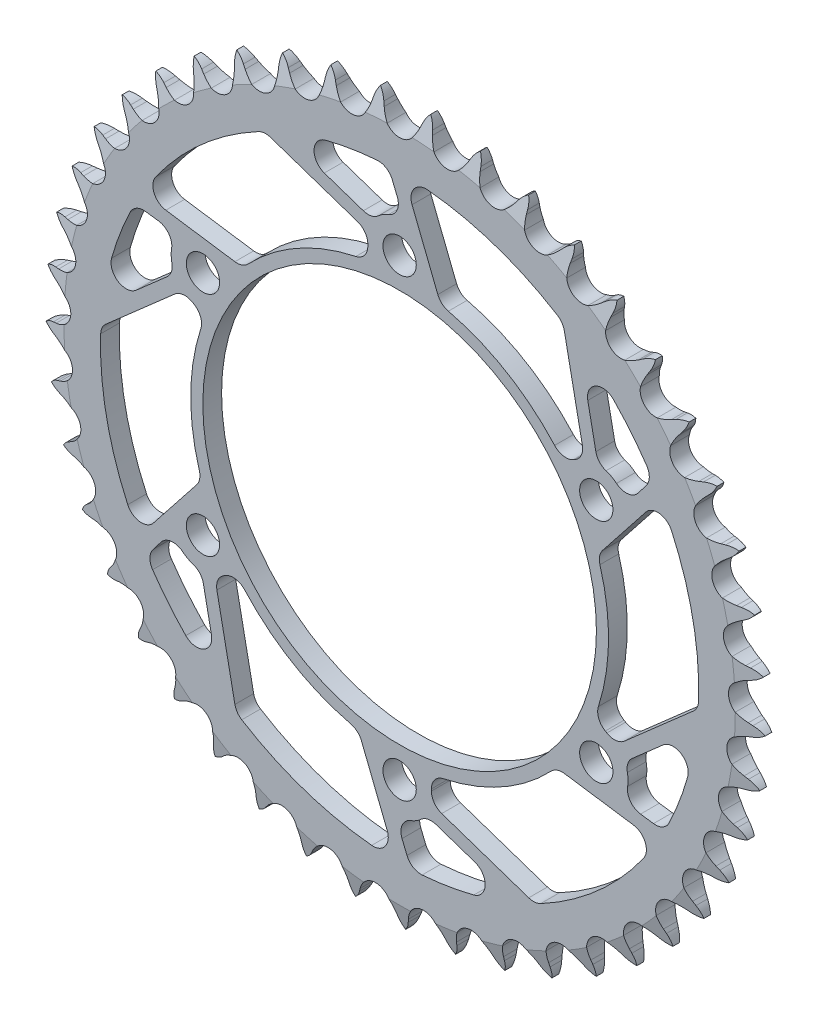
from build123d import *

# Parameters (mm, degrees)
BOSS_EXTRUDE2_DEPTH      = 6.1976
M10_CLEARANCE_HOLE1_D    = 11
SKETCH5_R                = 65
CUT_EXTRUDE1_DEPTH       = 169.066931826
CUT_EXTRUDE5_DEPTH       = 169.066931826
FILLET1_R                = 5
CIRPATTERN1_COUNT        = 6
FILLET1_OF_CIRPATTERN1_R = 5


with BuildPart() as part:
    # Sketch2 → Boss-Extrude2 (new body)
    with BuildSketch(Plane.XY):
        with BuildLine():
            Line((5.956451436, 114.157319132), (6.387056113, 115.368083346))
            ThreePointArc((6.387056113, 115.368083346), (7.1593932, 117.045110566), (8.28683305, 118.507233768))
            ThreePointArc((8.28683305, 118.507233768), (9.199812512, 116.902430548), (9.731236189, 115.134235494))
            Line((9.731236189, 115.134235494), (9.989144441, 113.875325767))
            ThreePointArc((9.989144441, 113.875325767), (10.526532851, 112.014172711), (11.32913636, 110.251077533))
            ThreePointArc((11.32913636, 110.251077533), (15.123673948, 107.610531699), (19.499050656, 109.102870958))
            ThreePointArc((19.499050656, 109.102870958), (20.75653756, 110.57643931), (21.786111761, 112.217370132))
            Line((21.786111761, 112.217370132), (22.381031633, 113.356422684))
            ThreePointArc((22.381031633, 113.356422684), (23.379249467, 114.909640643), (24.69920537, 116.200625263))
            ThreePointArc((24.69920537, 116.200625263), (25.379954338, 114.484377695), (25.660121047, 112.659430712))
            Line((25.660121047, 112.659430712), (25.740312983, 111.376878716))
            ThreePointArc((25.740312983, 111.376878716), (26.013449124, 109.459048263), (26.562866328, 107.601410587))
            ThreePointArc((26.562866328, 107.601410587), (29.952982785, 104.458464801), (34.493472111, 105.327345972))
            ThreePointArc((34.493472111, 105.327345972), (35.943802315, 106.611565307), (37.191730202, 108.093237669))
            Line((37.191730202, 108.093237669), (37.939385831, 109.138408195))
            ThreePointArc((37.939385831, 109.138408195), (39.144055237, 110.537585273), (40.630835752, 111.632303763))
            ThreePointArc((40.630835752, 111.632303763), (41.066104223, 109.838016654), (41.089560838, 107.99183826))
            Line((41.089560838, 107.99183826), (40.990475613, 106.710607411))
            ThreePointArc((40.990475613, 106.710607411), (40.994043201, 104.773427948), (41.279580318, 102.857404578))
            ThreePointArc((41.279580318, 102.857404578), (44.199290883, 99.273232705), (48.816517366, 99.501744005))
            ThreePointArc((48.816517366, 99.501744005), (50.431461843, 100.571618453), (51.873453919, 101.865193288))
            Line((51.873453919, 101.865193288), (52.759293038, 102.796138735))
            ThreePointArc((52.759293038, 102.796138735), (54.146966498, 104.01404154), (55.771633134, 104.891186451))
            ThreePointArc((55.771633134, 104.891186451), (55.9529491, 103.053783557), (55.719239065, 101.222307515))
            Line((55.719239065, 101.222307515), (55.442805261, 99.967335515))
            ThreePointArc((55.442805261, 99.967335515), (55.176734856, 98.048512037), (55.192834232, 96.111396188))
            ThreePointArc((55.192834232, 96.111396188), (57.585310061, 92.155760056), (62.189404639, 91.739453773))
            ThreePointArc((62.189404639, 91.739453773), (63.937530332, 92.574159445), (65.545519861, 93.65445879))
            Line((65.545519861, 93.65445879), (66.55230062, 94.453059362))
            ThreePointArc((66.55230062, 94.453059362), (68.095968646, 95.465982803), (69.826899116, 96.108481506))
            ThreePointArc((69.826899116, 96.108481506), (69.750733469, 94.263725785), (69.264405684, 92.482599692))
            Line((69.264405684, 92.482599692), (68.81600377, 91.278313143))
            ThreePointArc((68.81600377, 91.278313143), (68.28547413, 89.415193367), (68.031822408, 87.494688797))
            ThreePointArc((68.031822408, 87.494688797), (69.85049668, 83.244580363), (74.35184589, 82.191559424))
            ThreePointArc((74.35184589, 82.191559424), (76.199127521, 82.774849725), (77.941816816, 83.620846782))
            Line((77.941816816, 83.620846782), (79.049943371, 84.271558628))
            ThreePointArc((79.049943371, 84.271558628), (80.719560223, 85.059787301), (82.523063933, 85.45513429))
            ThreePointArc((82.523063933, 85.45513429), (82.190899151, 83.638931815), (81.461419433, 81.942823264))
            Line((81.461419433, 81.942823264), (80.849777042, 80.812662234))
            ThreePointArc((80.849777042, 80.812662234), (80.065114323, 79.041509666), (79.546648547, 77.174996811))
            ThreePointArc((79.546648547, 77.174996811), (80.756122835, 72.713139603), (85.067113035, 71.043899863))
            ThreePointArc((85.067113035, 71.043899863), (86.977595368, 71.36442171), (88.821064964, 71.959650108))
            Line((88.821064964, 71.959650108), (90.008968894, 72.449807863))
            ThreePointArc((90.008968894, 72.449807863), (91.772037378, 72.997999794), (93.61301118, 73.138500089))
            ThreePointArc((93.61301118, 73.138500089), (93.031312472, 71.386201174), (92.072879314, 69.80812299))
            Line((92.072879314, 69.80812299), (91.30990137, 68.774084777))
            ThreePointArc((91.30990137, 68.774084777), (90.28637814, 67.129372889), (89.513189654, 65.353181298))
            ThreePointArc((89.513189654, 65.353181298), (90.089922918, 60.76642029), (94.126645586, 58.513451603))
            ThreePointArc((94.126645586, 58.513451603), (96.063143256, 58.564966402), (97.971512115, 58.897840698))
            Line((97.971512115, 58.897840698), (99.21607222, 59.217903998))
            ThreePointArc((99.21607222, 59.217903998), (101.038276214, 59.515389255), (102.880887647, 59.398308178))
            ThreePointArc((102.880887647, 59.398308178), (102.060977118, 57.744019328), (100.892245331, 56.314687007))
            Line((100.892245331, 56.314687007), (99.99278233, 55.39689799))
            ThreePointArc((99.99278233, 55.39689799), (98.750320304, 53.910639226), (97.737458344, 52.259340449))
            ThreePointArc((97.737458344, 52.259340449), (97.670225127, 47.636951727), (101.354110049, 44.844105565))
            ThreePointArc((101.354110049, 44.844105565), (103.278931331, 44.62561064), (105.215055224, 44.689651814))
            Line((105.215055224, 44.689651814), (106.492047557, 44.833390991))
            ThreePointArc((106.492047557, 44.833390991), (108.337919933, 44.874379361), (110.146304662, 44.501995762))
            ThreePointArc((110.146304662, 44.501995762), (109.104140936, 42.977915829), (107.747858555, 41.725149699))
            Line((107.747858555, 41.725149699), (106.729417523, 40.941473596))
            ThreePointArc((106.729417523, 40.941473596), (105.292199811, 39.642596294), (104.059378583, 38.148330983))
            ThreePointArc((104.059378583, 38.148330983), (103.349487502, 33.580284085), (106.608832049, 30.301920022))
            ThreePointArc((106.608832049, 30.301920022), (108.484512486, 29.817668128), (110.410706963, 29.611629692))
            Line((110.410706963, 29.611629692), (111.695276321, 29.576247026))
            ThreePointArc((111.695276321, 29.576247026), (113.528889273, 29.359940718), (115.267849146, 28.739502619))
            ThreePointArc((115.267849146, 28.739502619), (114.023716755, 27.375296085), (112.506282274, 26.323479813))
            Line((112.506282274, 26.323479813), (111.388686007, 25.689169989))
            ThreePointArc((111.388686007, 25.689169989), (109.784686417, 24.602955317), (108.355901383, 23.294807647))
            ThreePointArc((108.355901383, 23.294807647), (107.017169662, 18.87001441), (109.788534398, 15.169942073))
            ThreePointArc((109.788534398, 15.169942073), (111.578566005, 14.429358622), (113.457339881, 13.95725088))
            Line((113.457339881, 13.95725088), (114.724483584, 13.743435054))
            ThreePointArc((114.724483584, 13.743435054), (116.51014792, 13.274044224), (118.145836061, 12.417627749))
            ThreePointArc((118.145836061, 12.417627749), (116.723950628, 11.239847342), (115.074899183, 10.409453336))
            Line((115.074899183, 10.409453336), (113.87990042, 9.936855909))
            ThreePointArc((113.87990042, 9.936855909), (112.14033898, 9.0844458), (110.543399816, 7.987877377))
            ThreePointArc((110.543399816, 7.987877377), (108.601884344, 3.79246137), (110.831327808, -0.257301542))
            ThreePointArc((110.831327808, -0.257301542), (112.500869655, -1.239801935), (114.295654735, -1.968789944))
            Line((114.295654735, -1.968789944), (115.52070927, -2.356877247))
            ThreePointArc((115.52070927, -2.356877247), (117.223669066, -3.070216441), (118.724248666, -4.145942121))
            ThreePointArc((118.724248666, -4.145942121), (117.152285573, -5.114372245), (115.403714074, -5.70718131))
            Line((115.403714074, -5.70718131), (114.154572108, -6.008867768))
            ThreePointArc((114.154572108, -6.008867768), (112.313307402, -6.61088212), (110.579296712, -7.474527839))
            ThreePointArc((110.579296712, -7.474527839), (108.07278688, -11.358907618), (109.716915491, -15.679537076))
            ThreePointArc((109.716915491, -15.679537076), (111.233471845, -16.884831159), (112.909334678, -17.856510512))
            Line((112.909334678, -17.856510512), (114.068455753, -18.411315614))
            ThreePointArc((114.068455753, -18.411315614), (115.655564835, -19.354718836), (116.991828818, -20.628815943))
            ThreePointArc((116.991828818, -20.628815943), (115.300384538, -21.369046394), (113.486326941, -21.712732164))
            Line((113.486326941, -21.712732164), (112.207354899, -21.837635669))
            ThreePointArc((112.207354899, -21.837635669), (110.30022505, -22.17753674), (108.462893381, -22.791449874))
            ThreePointArc((108.462893381, -22.791449874), (105.44017555, -26.289188389), (106.466988215, -30.796588256))
            ThreePointArc((106.466988215, -30.796588256), (107.801041032, -32.20121635), (109.325362854, -33.396674413))
            Line((109.325362854, -33.396674413), (110.395989497, -34.107398665))
            ThreePointArc((110.395989497, -34.107398665), (111.836356589, -35.262503644), (112.982296098, -36.710173328))
            ThreePointArc((112.982296098, -36.710173328), (111.20429267, -37.207796361), (109.360057543, -37.295669384))
            Line((109.360057543, -37.295669384), (108.076149161, -37.241358831))
            ThreePointArc((108.076149161, -37.241358831), (106.140274282, -37.312530834), (104.235383204, -37.664762261))
            ThreePointArc((104.235383204, -37.664762261), (100.75529114, -40.707780012), (101.144802118, -45.314218876))
            ThreePointArc((101.144802118, -45.314218876), (102.270385577, -46.890841493), (103.613497198, -48.286810036))
            Line((103.613497198, -48.286810036), (104.574790878, -49.139619998))
            ThreePointArc((104.574790878, -49.139619998), (105.840380875, -50.483943929), (106.773691501, -52.077008946))
            ThreePointArc((106.773691501, -52.077008946), (104.943735739, -52.322338896), (103.10521902, -52.152688823))
            Line((103.10521902, -52.152688823), (101.841364114, -51.920221306))
            ThreePointArc((101.841364114, -51.920221306), (99.914423809, -51.721278957), (97.979049859, -51.804972894))
            ThreePointArc((97.979049859, -51.804972894), (94.109319595, -54.334041002), (93.853947498, -58.949859769))
            ThreePointArc((93.853947498, -58.949859769), (94.749153398, -60.667789744), (95.884912678, -62.237097826))
            Line((95.884912678, -62.237097826), (96.718162906, -63.215394522))
            ThreePointArc((96.718162906, -63.215394522), (97.784342539, -64.72277167), (98.486858451, -66.430224822))
            ThreePointArc((98.486858451, -66.430224822), (96.640568363, -66.41848662), (94.843554689, -65.994615497))
            Line((94.843554689, -65.994615497), (93.624352758, -65.588515731))
            ThreePointArc((93.624352758, -65.588515731), (91.743852726, -65.123331218), (89.815665758, -64.936858657))
            ThreePointArc((89.815665758, -64.936858657), (85.631617192, -66.902751687), (84.736332548, -71.438108697))
            ThreePointArc((84.736332548, -71.438108697), (85.383736723, -73.263908476), (86.2900374, -74.976011301))
            Line((86.2900374, -74.976011301), (86.979025909, -76.060753299))
            ThreePointArc((86.979025909, -76.060753299), (87.825043203, -77.701844282), (88.283090729, -79.490451935))
            ThreePointArc((88.283090729, -79.490451935), (86.456402251, -79.221874051), (84.735868449, -78.552032047))
            Line((84.735868449, -78.552032047), (83.585049871, -77.980204303))
            ThreePointArc((83.585049871, -77.980204303), (81.787591908, -77.257831913), (79.904121887, -76.804822331))
            ThreePointArc((79.904121887, -76.804822331), (75.487192765, -78.169276411), (73.96942127, -82.535896099))
            ThreePointArc((73.96942127, -82.535896099), (74.356422735, -84.434028567), (75.015624697, -86.255602))
            Line((75.015624697, -86.255602), (75.54694111, -87.425676031))
            ThreePointArc((75.54694111, -87.425676031), (76.156329301, -89.168538879), (76.360993066, -91.00348782))
            ThreePointArc((76.360993066, -91.00348782), (74.589460612, -90.483297818), (72.978894916, -89.580522646))
            Line((72.978894916, -89.580522646), (71.918859065, -88.8540969))
            ThreePointArc((71.918859065, -88.8540969), (70.239428645, -87.88859679), (68.437335173, -87.177867502))
            ThreePointArc((68.437335173, -87.177867502), (63.873495996, -87.914325087), (61.762779346, -92.027216166))
            ThreePointArc((61.762779346, -92.027216166), (61.881845558, -93.960736333), (62.281118189, -95.85632552))
            Line((62.281118189, -95.85632552), (62.644421036, -97.088957424))
            ThreePointArc((62.644421036, -97.088957424), (63.005319075, -98.899669295), (62.952615532, -100.74524433))
            ThreePointArc((62.952615532, -100.74524433), (61.270719966, -99.983567116), (59.801470205, -98.865430267))
            Line((59.801470205, -98.865430267), (58.852849474, -97.99854557))
            ThreePointArc((58.852849474, -97.99854557), (57.324134799, -96.808710101), (55.638493576, -95.854094646))
            ThreePointArc((55.638493576, -95.854094646), (51.016574283, -95.948221425), (48.353995177, -99.72733115))
            ThreePointArc((48.353995177, -99.72733115), (48.202808647, -101.658605246), (48.334380559, -103.591314699))
            Line((48.334380559, -103.591314699), (48.522598563, -104.862512698))
            ThreePointArc((48.522598563, -104.862512698), (48.627981981, -106.705830144), (48.318936945, -108.526109255))
            ThreePointArc((48.318936945, -108.526109255), (46.759414451, -107.537770009), (45.460077899, -106.226034747))
            Line((45.460077899, -106.226034747), (44.641336112, -105.235564023))
            ThreePointArc((44.641336112, -105.235564023), (43.293091875, -103.844551989), (41.75671199, -102.66463087))
            ThreePointArc((41.75671199, -102.66463087), (37.166672982, -102.114594773), (34.004055493, -105.486367071))
            ThreePointArc((34.004055493, -105.486367071), (33.585558896, -107.377805042), (33.446869191, -109.310016771))
            Line((33.446869191, -109.310016771), (33.456338903, -110.595038441))
            ThreePointArc((33.456338903, -110.595038441), (33.304156532, -112.435083386), (32.744785212, -114.194636909))
            ThreePointArc((32.744785212, -114.194636909), (31.337990121, -112.998872532), (30.233856888, -111.51907029))
            Line((30.233856888, -111.51907029), (29.560929921, -110.424291926))
            ThreePointArc((29.560929921, -110.424291926), (28.419398163, -108.859177794), (27.062183502, -107.476916833))
            ThreePointArc((27.062183502, -107.476916833), (22.593364667, -106.293423688), (18.992265548, -109.192230846))
            ThreePointArc((18.992265548, -109.192230846), (18.314604443, -111.007018004), (17.908352559, -112.901123704))
            Line((17.908352559, -112.901123704), (17.738889662, -114.174957562))
            ThreePointArc((17.738889662, -114.174957562), (17.332103558, -115.975915623), (16.533293482, -117.640495851))
            ThreePointArc((16.533293482, -117.640495851), (15.30660746, -116.260580536), (14.419168243, -114.641513981))
            Line((14.419168243, -114.641513981), (13.905153855, -113.463736592))
            ThreePointArc((13.905153855, -113.463736592), (12.992553192, -111.754983529), (11.840920395, -110.197286863))
            ThreePointArc((11.840920395, -110.197286863), (7.580302209, -108.403372017), (3.610812758, -110.772792052))
            ThreePointArc((3.610812758, -110.772792052), (2.687177048, -112.475605628), (2.021270215, -114.294738688))
            Line((2.021270215, -114.294738688), (1.676173111, -115.532591005))
            ThreePointArc((1.676173111, -115.532591005), (1.022700904, -117.259408583), (0, -118.796616355))
            ThreePointArc((0, -118.796616355), (-1.022700904, -117.259408583), (-1.676173111, -115.532591005))
            Line((-1.676173111, -115.532591005), (-2.021270215, -114.294738688))
            ThreePointArc((-2.021270215, -114.294738688), (-2.687177048, -112.475605628), (-3.610812758, -110.772792052))
            ThreePointArc((-3.610812758, -110.772792052), (-7.580302209, -108.403372017), (-11.840920395, -110.197286863))
            ThreePointArc((-11.840920395, -110.197286863), (-12.992553192, -111.754983529), (-13.905153855, -113.463736592))
            Line((-13.905153855, -113.463736592), (-14.419168243, -114.641513981))
            ThreePointArc((-14.419168243, -114.641513981), (-15.30660746, -116.260580536), (-16.533293482, -117.640495851))
            ThreePointArc((-16.533293482, -117.640495851), (-17.332103558, -115.975915623), (-17.738889662, -114.174957562))
            Line((-17.738889662, -114.174957562), (-17.908352559, -112.901123704))
            ThreePointArc((-17.908352559, -112.901123704), (-18.314604443, -111.007018004), (-18.992265548, -109.192230846))
            ThreePointArc((-18.992265548, -109.192230846), (-22.593364667, -106.293423688), (-27.062183502, -107.476916833))
            ThreePointArc((-27.062183502, -107.476916833), (-28.419398163, -108.859177794), (-29.560929921, -110.424291926))
            Line((-29.560929921, -110.424291926), (-30.233856888, -111.51907029))
            ThreePointArc((-30.233856888, -111.51907029), (-31.337990121, -112.998872532), (-32.744785212, -114.194636909))
            ThreePointArc((-32.744785212, -114.194636909), (-33.304156532, -112.435083386), (-33.456338903, -110.595038441))
            Line((-33.456338903, -110.595038441), (-33.446869191, -109.310016771))
            ThreePointArc((-33.446869191, -109.310016771), (-33.585558896, -107.377805042), (-34.004055493, -105.486367071))
            ThreePointArc((-34.004055493, -105.486367071), (-37.166672982, -102.114594773), (-41.75671199, -102.66463087))
            ThreePointArc((-41.75671199, -102.66463087), (-43.293091875, -103.844551989), (-44.641336112, -105.235564023))
            Line((-44.641336112, -105.235564023), (-45.460077899, -106.226034747))
            ThreePointArc((-45.460077899, -106.226034747), (-46.759414451, -107.537770009), (-48.318936945, -108.526109255))
            ThreePointArc((-48.318936945, -108.526109255), (-48.627981981, -106.705830144), (-48.522598563, -104.862512698))
            Line((-48.522598563, -104.862512698), (-48.334380559, -103.591314699))
            ThreePointArc((-48.334380559, -103.591314699), (-48.202808647, -101.658605246), (-48.353995177, -99.72733115))
            ThreePointArc((-48.353995177, -99.72733115), (-51.016574283, -95.948221425), (-55.638493576, -95.854094646))
            ThreePointArc((-55.638493576, -95.854094646), (-57.324134799, -96.808710101), (-58.852849474, -97.99854557))
            Line((-58.852849474, -97.99854557), (-59.801470205, -98.865430267))
            ThreePointArc((-59.801470205, -98.865430267), (-61.270719966, -99.983567116), (-62.952615532, -100.74524433))
            ThreePointArc((-62.952615532, -100.74524433), (-63.005319075, -98.899669295), (-62.644421036, -97.088957424))
            Line((-62.644421036, -97.088957424), (-62.281118189, -95.85632552))
            ThreePointArc((-62.281118189, -95.85632552), (-61.881845558, -93.960736333), (-61.762779346, -92.027216166))
            ThreePointArc((-61.762779346, -92.027216166), (-63.873495996, -87.914325087), (-68.437335173, -87.177867502))
            ThreePointArc((-68.437335173, -87.177867502), (-70.239428645, -87.88859679), (-71.918859065, -88.8540969))
            Line((-71.918859065, -88.8540969), (-72.978894916, -89.580522646))
            ThreePointArc((-72.978894916, -89.580522646), (-74.589460612, -90.483297818), (-76.360993066, -91.00348782))
            ThreePointArc((-76.360993066, -91.00348782), (-76.156329301, -89.168538879), (-75.54694111, -87.425676031))
            Line((-75.54694111, -87.425676031), (-75.015624697, -86.255602))
            ThreePointArc((-75.015624697, -86.255602), (-74.356422735, -84.434028567), (-73.96942127, -82.535896099))
            ThreePointArc((-73.96942127, -82.535896099), (-75.487192765, -78.169276411), (-79.904121887, -76.804822331))
            ThreePointArc((-79.904121887, -76.804822331), (-81.787591908, -77.257831913), (-83.585049871, -77.980204303))
            Line((-83.585049871, -77.980204303), (-84.735868449, -78.552032047))
            ThreePointArc((-84.735868449, -78.552032047), (-86.456402251, -79.221874051), (-88.283090729, -79.490451935))
            ThreePointArc((-88.283090729, -79.490451935), (-87.825043203, -77.701844282), (-86.979025909, -76.060753299))
            Line((-86.979025909, -76.060753299), (-86.2900374, -74.976011301))
            ThreePointArc((-86.2900374, -74.976011301), (-85.383736723, -73.263908476), (-84.736332548, -71.438108697))
            ThreePointArc((-84.736332548, -71.438108697), (-85.631617192, -66.902751687), (-89.815665758, -64.936858657))
            ThreePointArc((-89.815665758, -64.936858657), (-91.743852726, -65.123331218), (-93.624352758, -65.588515731))
            Line((-93.624352758, -65.588515731), (-94.843554689, -65.994615497))
            ThreePointArc((-94.843554689, -65.994615497), (-96.640568363, -66.41848662), (-98.486858451, -66.430224822))
            ThreePointArc((-98.486858451, -66.430224822), (-97.784342539, -64.72277167), (-96.718162906, -63.215394522))
            Line((-96.718162906, -63.215394522), (-95.884912678, -62.237097826))
            ThreePointArc((-95.884912678, -62.237097826), (-94.749153398, -60.667789744), (-93.853947498, -58.949859769))
            ThreePointArc((-93.853947498, -58.949859769), (-94.109319595, -54.334041002), (-97.979049859, -51.804972894))
            ThreePointArc((-97.979049859, -51.804972894), (-99.914423809, -51.721278957), (-101.841364114, -51.920221306))
            Line((-101.841364114, -51.920221306), (-103.10521902, -52.152688823))
            ThreePointArc((-103.10521902, -52.152688823), (-104.943735739, -52.322338896), (-106.773691501, -52.077008946))
            ThreePointArc((-106.773691501, -52.077008946), (-105.840380875, -50.483943929), (-104.574790878, -49.139619998))
            Line((-104.574790878, -49.139619998), (-103.613497198, -48.286810036))
            ThreePointArc((-103.613497198, -48.286810036), (-102.270385577, -46.890841493), (-101.144802118, -45.314218876))
            ThreePointArc((-101.144802118, -45.314218876), (-100.75529114, -40.707780012), (-104.235383204, -37.664762261))
            ThreePointArc((-104.235383204, -37.664762261), (-106.140274282, -37.312530834), (-108.076149161, -37.241358831))
            Line((-108.076149161, -37.241358831), (-109.360057543, -37.295669384))
            ThreePointArc((-109.360057543, -37.295669384), (-111.20429267, -37.207796361), (-112.982296098, -36.710173328))
            ThreePointArc((-112.982296098, -36.710173328), (-111.836356589, -35.262503644), (-110.395989497, -34.107398665))
            Line((-110.395989497, -34.107398665), (-109.325362854, -33.396674413))
            ThreePointArc((-109.325362854, -33.396674413), (-107.801041032, -32.20121635), (-106.466988215, -30.796588256))
            ThreePointArc((-106.466988215, -30.796588256), (-105.44017555, -26.289188389), (-108.462893381, -22.791449874))
            ThreePointArc((-108.462893381, -22.791449874), (-110.30022505, -22.17753674), (-112.207354899, -21.837635669))
            Line((-112.207354899, -21.837635669), (-113.486326941, -21.712732164))
            ThreePointArc((-113.486326941, -21.712732164), (-115.300384538, -21.369046394), (-116.991828818, -20.628815943))
            ThreePointArc((-116.991828818, -20.628815943), (-115.655564835, -19.354718836), (-114.068455753, -18.411315614))
            Line((-114.068455753, -18.411315614), (-112.909334678, -17.856510512))
            ThreePointArc((-112.909334678, -17.856510512), (-111.233471845, -16.884831159), (-109.716915491, -15.679537076))
            ThreePointArc((-109.716915491, -15.679537076), (-108.07278688, -11.358907618), (-110.579296712, -7.474527839))
            ThreePointArc((-110.579296712, -7.474527839), (-112.313307402, -6.61088212), (-114.154572108, -6.008867768))
            Line((-114.154572108, -6.008867768), (-115.403714074, -5.70718131))
            ThreePointArc((-115.403714074, -5.70718131), (-117.152285573, -5.114372245), (-118.724248666, -4.145942121))
            ThreePointArc((-118.724248666, -4.145942121), (-117.223669066, -3.070216441), (-115.52070927, -2.356877247))
            Line((-115.52070927, -2.356877247), (-114.295654735, -1.968789944))
            ThreePointArc((-114.295654735, -1.968789944), (-112.500869655, -1.239801935), (-110.831327808, -0.257301542))
            ThreePointArc((-110.831327808, -0.257301542), (-108.601884344, 3.79246137), (-110.543399816, 7.987877377))
            ThreePointArc((-110.543399816, 7.987877377), (-112.14033898, 9.0844458), (-113.87990042, 9.936855909))
            Line((-113.87990042, 9.936855909), (-115.074899183, 10.409453336))
            ThreePointArc((-115.074899183, 10.409453336), (-116.723950628, 11.239847342), (-118.145836061, 12.417627749))
            ThreePointArc((-118.145836061, 12.417627749), (-116.51014792, 13.274044224), (-114.724483584, 13.743435054))
            Line((-114.724483584, 13.743435054), (-113.457339881, 13.95725088))
            ThreePointArc((-113.457339881, 13.95725088), (-111.578566005, 14.429358622), (-109.788534398, 15.169942073))
            ThreePointArc((-109.788534398, 15.169942073), (-107.017169662, 18.87001441), (-108.355901383, 23.294807647))
            ThreePointArc((-108.355901383, 23.294807647), (-109.784686417, 24.602955317), (-111.388686007, 25.689169989))
            Line((-111.388686007, 25.689169989), (-112.506282274, 26.323479813))
            ThreePointArc((-112.506282274, 26.323479813), (-114.023716755, 27.375296085), (-115.267849146, 28.739502619))
            ThreePointArc((-115.267849146, 28.739502619), (-113.528889273, 29.359940718), (-111.695276321, 29.576247026))
            Line((-111.695276321, 29.576247026), (-110.410706963, 29.611629692))
            ThreePointArc((-110.410706963, 29.611629692), (-108.484512486, 29.817668128), (-106.608832049, 30.301920022))
            ThreePointArc((-106.608832049, 30.301920022), (-103.349487502, 33.580284085), (-104.059378583, 38.148330983))
            ThreePointArc((-104.059378583, 38.148330983), (-105.292199811, 39.642596294), (-106.729417523, 40.941473596))
            Line((-106.729417523, 40.941473596), (-107.747858555, 41.725149699))
            ThreePointArc((-107.747858555, 41.725149699), (-109.104140936, 42.977915829), (-110.146304662, 44.501995762))
            ThreePointArc((-110.146304662, 44.501995762), (-108.337919933, 44.874379361), (-106.492047557, 44.833390991))
            Line((-106.492047557, 44.833390991), (-105.215055224, 44.689651814))
            ThreePointArc((-105.215055224, 44.689651814), (-103.278931331, 44.62561064), (-101.354110049, 44.844105565))
            ThreePointArc((-101.354110049, 44.844105565), (-97.670225127, 47.636951727), (-97.737458344, 52.259340449))
            ThreePointArc((-97.737458344, 52.259340449), (-98.750320304, 53.910639226), (-99.99278233, 55.39689799))
            Line((-99.99278233, 55.39689799), (-100.892245331, 56.314687007))
            ThreePointArc((-100.892245331, 56.314687007), (-102.060977118, 57.744019328), (-102.880887647, 59.398308178))
            ThreePointArc((-102.880887647, 59.398308178), (-101.038276214, 59.515389255), (-99.21607222, 59.217903998))
            Line((-99.21607222, 59.217903998), (-97.971512115, 58.897840698))
            ThreePointArc((-97.971512115, 58.897840698), (-96.063143256, 58.564966402), (-94.126645586, 58.513451603))
            ThreePointArc((-94.126645586, 58.513451603), (-90.089922918, 60.76642029), (-89.513189654, 65.353181298))
            ThreePointArc((-89.513189654, 65.353181298), (-90.28637814, 67.129372889), (-91.30990137, 68.774084777))
            Line((-91.30990137, 68.774084777), (-92.072879314, 69.80812299))
            ThreePointArc((-92.072879314, 69.80812299), (-93.031312472, 71.386201174), (-93.61301118, 73.138500089))
            ThreePointArc((-93.61301118, 73.138500089), (-91.772037378, 72.997999794), (-90.008968894, 72.449807863))
            Line((-90.008968894, 72.449807863), (-88.821064964, 71.959650108))
            ThreePointArc((-88.821064964, 71.959650108), (-86.977595368, 71.36442171), (-85.067113035, 71.043899863))
            ThreePointArc((-85.067113035, 71.043899863), (-80.756122835, 72.713139603), (-79.546648547, 77.174996811))
            ThreePointArc((-79.546648547, 77.174996811), (-80.065114323, 79.041509666), (-80.849777042, 80.812662234))
            Line((-80.849777042, 80.812662234), (-81.461419433, 81.942823264))
            ThreePointArc((-81.461419433, 81.942823264), (-82.190899151, 83.638931815), (-82.523063933, 85.45513429))
            ThreePointArc((-82.523063933, 85.45513429), (-80.719560223, 85.059787301), (-79.049943371, 84.271558628))
            Line((-79.049943371, 84.271558628), (-77.941816816, 83.620846782))
            ThreePointArc((-77.941816816, 83.620846782), (-76.199127521, 82.774849725), (-74.35184589, 82.191559424))
            ThreePointArc((-74.35184589, 82.191559424), (-69.85049668, 83.244580363), (-68.031822408, 87.494688797))
            ThreePointArc((-68.031822408, 87.494688797), (-68.28547413, 89.415193367), (-68.81600377, 91.278313143))
            Line((-68.81600377, 91.278313143), (-69.264405684, 92.482599692))
            ThreePointArc((-69.264405684, 92.482599692), (-69.750733469, 94.263725785), (-69.826899116, 96.108481506))
            ThreePointArc((-69.826899116, 96.108481506), (-68.095968646, 95.465982803), (-66.55230062, 94.453059362))
            Line((-66.55230062, 94.453059362), (-65.545519861, 93.65445879))
            ThreePointArc((-65.545519861, 93.65445879), (-63.937530332, 92.574159445), (-62.189404639, 91.739453773))
            ThreePointArc((-62.189404639, 91.739453773), (-57.585310061, 92.155760056), (-55.192834232, 96.111396188))
            ThreePointArc((-55.192834232, 96.111396188), (-55.176734856, 98.048512037), (-55.442805261, 99.967335515))
            Line((-55.442805261, 99.967335515), (-55.719239065, 101.222307515))
            ThreePointArc((-55.719239065, 101.222307515), (-55.9529491, 103.053783557), (-55.771633134, 104.891186451))
            ThreePointArc((-55.771633134, 104.891186451), (-54.146966498, 104.01404154), (-52.759293038, 102.796138735))
            Line((-52.759293038, 102.796138735), (-51.873453919, 101.865193288))
            ThreePointArc((-51.873453919, 101.865193288), (-50.431461843, 100.571618453), (-48.816517366, 99.501744005))
            ThreePointArc((-48.816517366, 99.501744005), (-44.199290883, 99.273232705), (-41.279580318, 102.857404578))
            ThreePointArc((-41.279580318, 102.857404578), (-40.994043201, 104.773427948), (-40.990475613, 106.710607411))
            Line((-40.990475613, 106.710607411), (-41.089560838, 107.99183826))
            ThreePointArc((-41.089560838, 107.99183826), (-41.066104223, 109.838016654), (-40.630835752, 111.632303763))
            ThreePointArc((-40.630835752, 111.632303763), (-39.144055237, 110.537585273), (-37.939385831, 109.138408195))
            Line((-37.939385831, 109.138408195), (-37.191730202, 108.093237669))
            ThreePointArc((-37.191730202, 108.093237669), (-35.943802315, 106.611565307), (-34.493472111, 105.327345972))
            ThreePointArc((-34.493472111, 105.327345972), (-29.952982785, 104.458464801), (-26.562866328, 107.601410587))
            ThreePointArc((-26.562866328, 107.601410587), (-26.013449124, 109.459048263), (-25.740312983, 111.376878716))
            Line((-25.740312983, 111.376878716), (-25.660121047, 112.659430712))
            ThreePointArc((-25.660121047, 112.659430712), (-25.379954338, 114.484377695), (-24.69920537, 116.200625263))
            ThreePointArc((-24.69920537, 116.200625263), (-23.379249467, 114.909640643), (-22.381031633, 113.356422684))
            Line((-22.381031633, 113.356422684), (-21.786111761, 112.217370132))
            ThreePointArc((-21.786111761, 112.217370132), (-20.75653756, 110.57643931), (-19.499050656, 109.102870958))
            ThreePointArc((-19.499050656, 109.102870958), (-15.123673948, 107.610531699), (-11.32913636, 110.251077533))
            ThreePointArc((-11.32913636, 110.251077533), (-10.526532851, 112.014172711), (-9.989144441, 113.875325767))
            Line((-9.989144441, 113.875325767), (-9.731236189, 115.134235494))
            ThreePointArc((-9.731236189, 115.134235494), (-9.199812512, 116.902430548), (-8.28683305, 118.507233768))
            ThreePointArc((-8.28683305, 118.507233768), (-7.1593932, 117.045110566), (-6.387056113, 115.368083346))
            Line((-6.387056113, 115.368083346), (-5.956451436, 114.157319132))
            ThreePointArc((-5.956451436, 114.157319132), (-5.165270411, 112.389068701), (-4.125102361, 110.754832664))
            ThreePointArc((-4.125102361, 110.754832664), (0, 108.668082003), (4.125102361, 110.754832664))
            ThreePointArc((4.125102361, 110.754832664), (5.165270411, 112.389068701), (5.956451436, 114.157319132))
        make_face()
    extrude(amount=BOSS_EXTRUDE2_DEPTH)

    # Sketch4 → Cut-Revolve1 (revolve, cut)
    with BuildSketch(Plane(origin=(0, 0, 0), x_dir=(0, 0, -1), z_dir=(0.9781476007338068, 0.2079116908177541, 0))):
        Polygon((-6.1976, 118.796616355), (-6.1976, 110.859116355), (-4.213225, 118.796616355), align=None)
        Polygon((0, 110.859116355), (0, 118.796616355), (-1.984375, 118.796616355), align=None)
    revolve(axis=Axis((0, 0, -0.30988), (0, 0, 1)), mode=Mode.SUBTRACT)

    # M10 Clearance Hole1 (through all)
    with Locations(Plane.XY.offset(6.1976)):
        with Locations((0, 75), (64.951905284, 37.5), (64.951905284, -37.5), (0, -75), (-64.951905284, -37.5), (-64.951905284, 37.5)):
            Hole(M10_CLEARANCE_HOLE1_D / 2)

    # Sketch5 → Cut-Extrude1 (cut, through all)
    with BuildSketch(Plane.XY.offset(6.1976)):
        Circle(SKETCH5_R)
    extrude(amount=-CUT_EXTRUDE1_DEPTH, mode=Mode.SUBTRACT)

    # Sketch9 → Cut-Extrude5 (cut, through all)
    with BuildSketch(Plane.XY.offset(6.1976)):
        with BuildLine():
            ThreePointArc((-51.782185908, 45.602688765), (-33.126827531, 60.527789467), (-10.5, 68.19640753))
            Line((-10.5, 68.19640753), (-10.5, 75))
            ThreePointArc((-10.5, 75), (-10.472242701, 75.76297629), (-10.389117558, 76.521918644))
            Line((-10.389117558, 76.521918644), (-44.658054282, 88.118498527))
            ThreePointArc((-44.658054282, 88.118498527), (-67.480954393, 72.149375529), (-84.938839715, 50.444078967))
            Line((-84.938839715, 50.444078967), (-51.782185908, 45.602688765))
        make_face()
        with BuildLine():
            Line((-38.817768828, 90.842679497), (-8.823018841, 80.692480876))
            ThreePointArc((-8.823018841, 80.692480876), (-4.26232366, 84.595967748), (1.691586925, 85.362843899))
            Line((1.691586925, 85.362843899), (-3.789623393, 98.716008578))
            ThreePointArc((-3.789623393, 98.716008578), (-21.664366957, 96.383955093), (-38.817768828, 90.842679497))
        make_face()
    cut_extrude5 = extrude(amount=-CUT_EXTRUDE5_DEPTH, mode=Mode.SUBTRACT)

    # Fillet1
    fillet1_edges = [part.edges().sort_by_distance(p)[0] for p in [
        (-51.782185908, 45.602688765, 3.0988),
        (-84.938839715, 50.444078967, 3.0988),
        (-10.5, 68.19640753, 3.0988),
        (-10.389117558, 76.521918644, 3.0988),
        (-44.658054282, 88.118498527, 3.0988),
        (-8.823018841, 80.692480876, 3.0988),
        (1.691586925, 85.362843899, 3.0988),
        (-3.789623393, 98.716008578, 3.0988),
        (-38.817768828, 90.842679497, 3.0988),
    ]]
    fillet(fillet1_edges, radius=FILLET1_R)

    # CirPattern1: Cut-Extrude5 ×6 about axis
    cirpattern1_axis = Axis((0, 0, -0.30988), (0, 0, 1))
    for i in range(1, CIRPATTERN1_COUNT):
        add(cut_extrude5.rotate(cirpattern1_axis, i * 360 / CIRPATTERN1_COUNT), mode=Mode.SUBTRACT)

    # Fillet1 of CirPattern1
    fillet1_of_cirpattern1_edges = [part.edges().sort_by_distance(p)[0] for p in [
        (-65.384179905, -22.043344078, 3.0988),
        (-86.155273713, -48.337153478, 3.0988),
        (-64.309821368, 25.004937025, 3.0988),
        (-71.464484272, 29.263719594, 3.0988),
        (-98.641885409, 5.384239772, 3.0988),
        (-74.293247754, 32.705281983, 3.0988),
        (-73.080597893, 44.1463792, 3.0988),
        (-87.385382885, 46.07609416, 3.0988),
        (-98.080952606, 11.804165826, 3.0988),
        (-13.601993997, -67.646032842, 3.0988),
        (-1.216433998, -98.781232445, 3.0988),
        (-53.809821368, -43.191470505, 3.0988),
        (-61.075366713, -47.258199051, 3.0988),
        (-53.983831127, -82.734258756, 3.0988),
        (-65.470228912, -47.987198893, 3.0988),
        (-74.772184818, -41.216464699, 3.0988),
        (-83.595759492, -52.639914418, 3.0988),
        (-59.263183779, -79.038513672, 3.0988),
        (51.782185908, -45.602688765, 3.0988),
        (84.938839715, -50.444078967, 3.0988),
        (10.5, -68.19640753, 3.0988),
        (10.389117558, -76.521918644, 3.0988),
        (44.658054282, -88.118498527, 3.0988),
        (8.823018841, -80.692480876, 3.0988),
        (-1.691586925, -85.362843899, 3.0988),
        (3.789623393, -98.716008578, 3.0988),
        (38.817768828, -90.842679497, 3.0988),
        (65.384179905, 22.043344078, 3.0988),
        (86.155273713, 48.337153478, 3.0988),
        (64.309821368, -25.004937025, 3.0988),
        (71.464484272, -29.263719594, 3.0988),
        (98.641885409, -5.384239772, 3.0988),
        (74.293247754, -32.705281983, 3.0988),
        (73.080597893, -44.1463792, 3.0988),
        (87.385382885, -46.07609416, 3.0988),
        (98.080952606, -11.804165826, 3.0988),
        (13.601993997, 67.646032842, 3.0988),
        (1.216433998, 98.781232445, 3.0988),
        (53.809821368, 43.191470505, 3.0988),
        (61.075366713, 47.258199051, 3.0988),
        (53.983831127, 82.734258756, 3.0988),
        (65.470228912, 47.987198893, 3.0988),
        (74.772184818, 41.216464699, 3.0988),
        (83.595759492, 52.639914418, 3.0988),
        (59.263183779, 79.038513672, 3.0988),
    ]]
    fillet(fillet1_of_cirpattern1_edges, radius=FILLET1_OF_CIRPATTERN1_R)


solid = part.part
